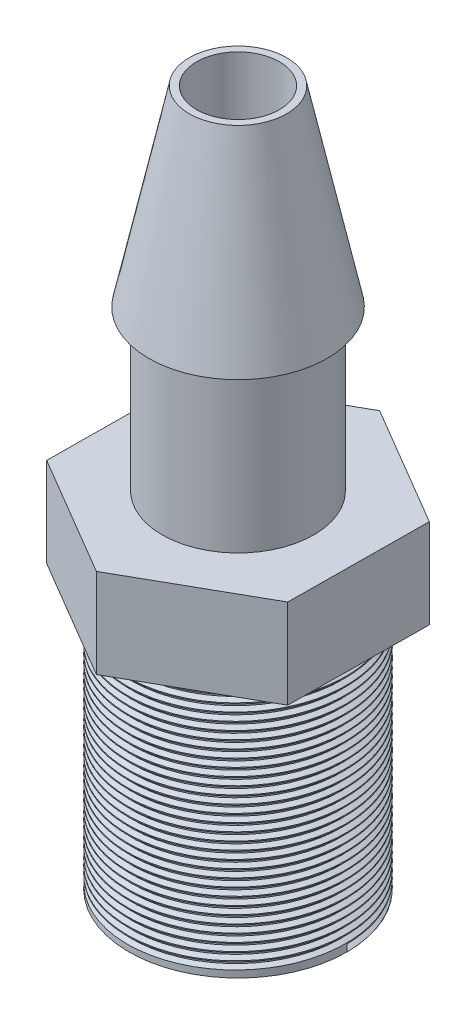
from build123d import *

# Parameters (mm, degrees)
BOSS_EXTRUDE1_DEPTH = 3.556
SKETCH3_R           = 3.0226
BOSS_EXTRUDE2_DEPTH = 6.35
SKETCH8_R           = 4.3434
BOSS_EXTRUDE3_DEPTH = 10.16
SKETCH9_R           = 3.556
BOSS_EXTRUDE4_DEPTH = 7.62
DRAFT1_ANGLE        = -12
SKETCH10_R          = 1.651
CUT_EXTRUDE1_DEPTH  = 7.62
SKETCH11_R          = 2.667
CUT_EXTRUDE2_DEPTH  = 7.62
THREAD1_PITCH       = 0.3175


with BuildPart() as part:
    # Sketch2 → Boss-Extrude1 (new body)
    with BuildSketch(Plane(origin=(0, 0, 0), x_dir=(1, 0, 0), z_dir=(0, 1, 0))):
        Polygon((4.814432948, -2.836719829), (4.863887909, 2.751061324), (0.049454961, 5.587781152), (-4.814432948, 2.836719829), (-4.863887909, -2.751061324), (-0.049454961, -5.587781152), align=None)
    extrude(amount=BOSS_EXTRUDE1_DEPTH)

    # Sketch3 → Boss-Extrude2 (add)
    with BuildSketch(Plane(origin=(0, 3.556, 0), x_dir=(1, 0, 0), z_dir=(0, 1, 0))):
        with Locations(Location((0, 0, 0), (0, 0, 270))):
            Circle(SKETCH3_R)
    extrude(amount=BOSS_EXTRUDE2_DEPTH)

    # Sketch8 → Boss-Extrude3 (add)
    with BuildSketch(Plane(origin=(0, 0, 0), x_dir=(-1, 0, 0), z_dir=(0, -1, 0))):
        with Locations(Location((0, 0, 0), (0, 0, 270))):
            Circle(SKETCH8_R)
    extrude(amount=BOSS_EXTRUDE3_DEPTH)

    # Sketch9 → Boss-Extrude4 (add)
    with BuildSketch(Plane(origin=(0, 9.906, 0), x_dir=(1, 0, 0), z_dir=(0, 1, 0))):
        with Locations(Location((0, 0, 0), (0, 0, 90))):
            Circle(SKETCH9_R)
    extrude(amount=BOSS_EXTRUDE4_DEPTH)

    # Draft1
    draft1_faces = [part.faces().sort_by_distance(p)[0] for p in [
        (0, 13.716, 3.556),
    ]]
    draft(draft1_faces, Plane(origin=(0, 9.906, 0), x_dir=(0, 0, -1), z_dir=(0, -1, 0)), DRAFT1_ANGLE)

    # Sketch10 → Cut-Extrude1 (cut)
    with BuildSketch(Plane(origin=(0, 17.526, 0), x_dir=(1, 0, 0), z_dir=(0, 1, 0))):
        with Locations(Location((0, 0, 0), (0, 0, 270))):
            Circle(SKETCH10_R)
    extrude(amount=-CUT_EXTRUDE1_DEPTH, mode=Mode.SUBTRACT)

    # Sketch11 → Cut-Extrude2 (cut)
    with BuildSketch(Plane.XZ.offset(10.16)):
        with Locations(Location((0, 0, 0), (0, 0, 270))):
            Circle(SKETCH11_R)
    extrude(amount=-CUT_EXTRUDE2_DEPTH, mode=Mode.SUBTRACT)

    # Thread1: the profile of Thread Profile1 profile screwed along a right-hand helix of 33 turns, 6 arcs to a turn; built about Z, then put on its axis
    thread1_z = Axis((0, 0, 0), (0, 0, 1))
    thread1_corners = [(4.3437, 0, -0.000173205), (4.3437, 0, 0.277985704), (4.171548085, 0, 0.17859375), (4.171548085, 0, 0.09921875)]
    with BuildLine(mode=Mode.PRIVATE) as thread1_profile:
        Line(thread1_corners[0], thread1_corners[1])
        Line(thread1_corners[1], thread1_corners[2])
        Line(thread1_corners[2], thread1_corners[3])
        Line(thread1_corners[3], thread1_corners[0])
    thread1_cap = Face(thread1_profile.wire())
    thread1_turn_angles = [0, 30, 60, 90, 120, 150, 180, 210, 240, 270, 300, 330, 360]
    thread1_turn_weights = [1, 0.8660254037844387, 1, 0.8660254037844387, 1, 0.8660254037844387, 1, 0.8660254037844387, 1, 0.8660254037844387, 1, 0.8660254037844387, 1]
    thread1_turn_rails = [Edge.make_bspline([Vector(p[0], p[1], 0).rotate(thread1_z, thread1_turn_angles[k]) / thread1_turn_weights[k] + Vector(0, 0, p[2] + THREAD1_PITCH * thread1_turn_angles[k] / 360) for k in range(13)], [0, 0, 0, 1, 1, 2, 2, 3, 3, 4, 4, 5, 5, 6, 6, 6], 2, thread1_turn_weights) for p in thread1_corners]
    thread1_turn_sides = [Face.make_surface_from_curves(thread1_turn_rails[p[0]], thread1_turn_rails[p[1]]) for p in [(0, 1), (1, 2), (2, 3), (3, 0)]]
    thread1 = Plane(origin=(0, -10.16, 0), x_dir=(1, 0, 0), z_dir=(0, 1, 0)) * Solid(Shell([*[p.moved(Location((0, 0, THREAD1_PITCH * i))) for i in range(33) for p in thread1_turn_sides], thread1_cap, thread1_cap.rotate(thread1_z, 11880).moved(Location((0, 0, THREAD1_PITCH * 11880 / 360)))]))
    add(thread1, mode=Mode.SUBTRACT)


solid = part.part
